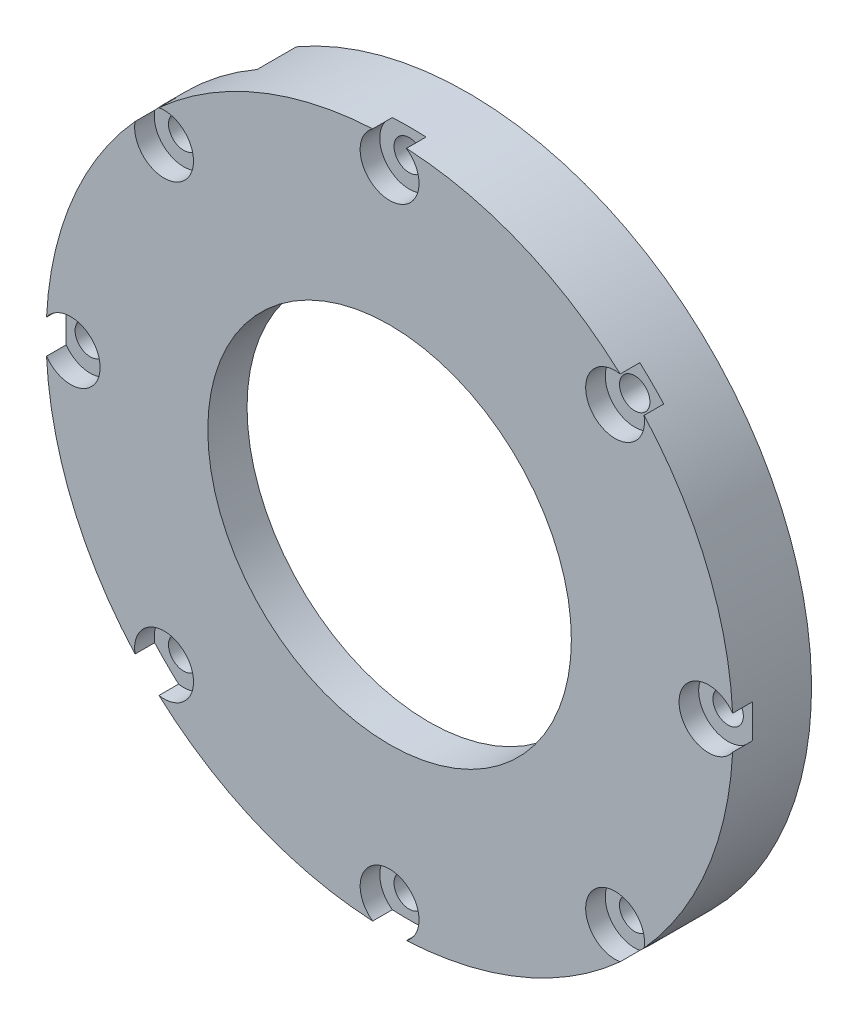
from build123d import *

# Parameters (mm, degrees)
EXTRUDE_1_OUTLINE_R   = 35
EXTRUDE_1_OUTLINE_R_2 = 1.55
EXTRUDE_1_OUTLINE_R_3 = 30.05
EXTRUDE_1_DEPTH       = 10
SKETCH_2_R            = 33.525
SKETCH_2_R_2          = 18.525
EXTRUDE_1_2_DEPTH     = 4
SKETCH_3_R            = 1.55
CUT_EXTRUDE_1_DEPTH   = 51.497524692
CUT_EXTRUDE_2_DEPTH   = 6
SKETCH_8_R            = 35
SKETCH_8_R_2          = 30.05
CUT_EXTRUDE_3_DEPTH   = 2
SKETCH_9_R            = 3
CUT_EXTRUDE_4_DEPTH   = 2
SKETCH_10_R           = 1.55
CUT_EXTRUDE_5_DEPTH   = 51.139804547
SKETCH_11_R           = 3
CUT_EXTRUDE_6_DEPTH   = 2


# Read off the part's stored shape, not the designer's step: 凸台-拉伸1
with BuildPart() as part:
    # Extrude 1 outline → Extrude 1 (new body)
    with BuildSketch(Plane.XY):
        Circle(EXTRUDE_1_OUTLINE_R)
        with Locations((0, -32.5)):
            Circle(EXTRUDE_1_OUTLINE_R_2, mode=Mode.SUBTRACT)
        with Locations((-32.5, 0)):
            Circle(EXTRUDE_1_OUTLINE_R_2, mode=Mode.SUBTRACT)
        Circle(EXTRUDE_1_OUTLINE_R_3, mode=Mode.SUBTRACT)
        with Locations((32.5, 0)):
            Circle(EXTRUDE_1_OUTLINE_R_2, mode=Mode.SUBTRACT)
        with Locations((0, 32.5)):
            Circle(EXTRUDE_1_OUTLINE_R_2, mode=Mode.SUBTRACT)
    extrude(amount=EXTRUDE_1_DEPTH)

    # 草图2 → Extrude 1 2 (add)
    with BuildSketch(Plane.XY.offset(10)):
        Circle(SKETCH_2_R)
        Circle(SKETCH_2_R_2, mode=Mode.SUBTRACT)
    extrude(amount=-EXTRUDE_1_2_DEPTH)

    # 草图3 → 切除-拉伸1 (cut, through all)
    with BuildSketch(Plane(origin=(0, 0, 0), x_dir=(-1, 0, 0), z_dir=(0, 0, -1))):
        with Locations(Location((32.5, 0, 0), (0, 0, 180))):
            Circle(SKETCH_3_R)
        with Locations(Location((0, -32.5, 0), (0, 0, 180))):
            Circle(SKETCH_3_R)
        with Locations(Location((-32.5, 0, 0), (0, 0, 180))):
            Circle(SKETCH_3_R)
        with Locations(Location((0, 32.5, 0), (0, 0, 180))):
            Circle(SKETCH_3_R)
    extrude(amount=-CUT_EXTRUDE_1_DEPTH, mode=Mode.SUBTRACT)

    # 草图7 → 切除-拉伸2 (cut)
    with BuildSketch(Plane(origin=(0, 0, 0), x_dir=(-1, 0, 0), z_dir=(0, 0, -1))):
        with BuildLine():
            Line((15.025, 26.024063384), (17.5, 30.310889132))
            ThreePointArc((17.5, 30.310889132), (24.748737342, 24.748737342), (30.310889132, 17.5))
            Line((30.310889132, 17.5), (26.024063384, 15.025))
            ThreePointArc((26.024063384, 15.025), (21.248558775, 21.248558775), (15.025, 26.024063384))
        make_face()
    extrude(amount=-CUT_EXTRUDE_2_DEPTH, mode=Mode.SUBTRACT)

    # 草图8 → 切除-拉伸3 (cut)
    with BuildSketch(Plane(origin=(0, 0, 0), x_dir=(-1, 0, 0), z_dir=(0, 0, -1))):
        with Locations(Location((0, 0, 0), (0, 0, 30))):
            Circle(SKETCH_8_R)
        Circle(SKETCH_8_R_2, mode=Mode.SUBTRACT)
    extrude(amount=-CUT_EXTRUDE_3_DEPTH, mode=Mode.SUBTRACT)

    # 草图9 → 切除-拉伸4 (cut)
    with BuildSketch(Plane.XY.offset(10)):
        with Locations((0, 32.5)):
            Circle(SKETCH_9_R)
        with Locations((32.5, 0)):
            Circle(SKETCH_9_R)
        with Locations((0, -32.5)):
            Circle(SKETCH_9_R)
        with Locations((-32.5, 0)):
            Circle(SKETCH_9_R)
    extrude(amount=-CUT_EXTRUDE_4_DEPTH, mode=Mode.SUBTRACT)

    # 草图10 → 切除-拉伸5 (cut, through all)
    with BuildSketch(Plane.XY.offset(10)):
        with Locations((22.980970389, 22.980970389)):
            Circle(SKETCH_10_R)
        with Locations((22.980970389, -22.980970389)):
            Circle(SKETCH_10_R)
        with Locations((-22.980970389, -22.980970389)):
            Circle(SKETCH_10_R)
        with Locations((-22.980970389, 22.980970389)):
            Circle(SKETCH_10_R)
    extrude(amount=-CUT_EXTRUDE_5_DEPTH, mode=Mode.SUBTRACT)

    # 草图11 → 切除-拉伸6 (cut)
    with BuildSketch(Plane.XY.offset(10)):
        with Locations((22.980970389, 22.980970389)):
            Circle(SKETCH_11_R)
        with Locations((22.980970389, -22.980970389)):
            Circle(SKETCH_11_R)
        with Locations((-22.980970389, -22.980970389)):
            Circle(SKETCH_11_R)
        with Locations((-22.980970389, 22.980970389)):
            Circle(SKETCH_11_R)
    extrude(amount=-CUT_EXTRUDE_6_DEPTH, mode=Mode.SUBTRACT)


solid = part.part
